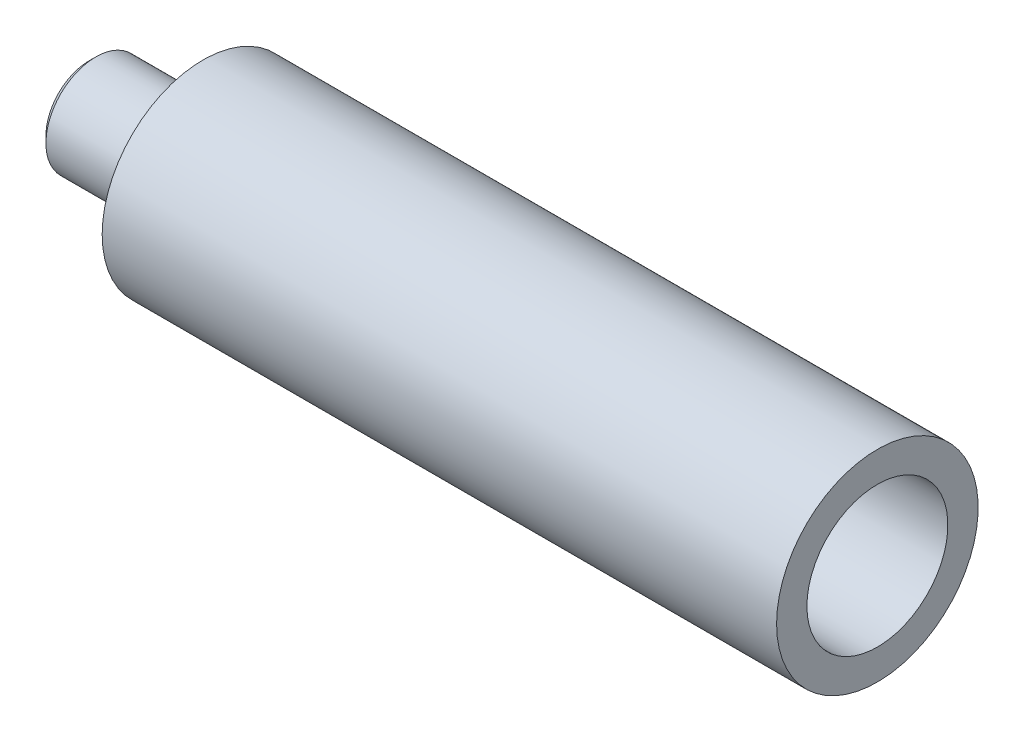
from build123d import *


# Read off the part's stored shape, not the designer's step: G1/4 Straight Pipe Tapped Thread Stud2
with BuildPart() as part:
    # Sketch1 → Revolve1 (revolve)
    with BuildSketch(Plane.XY, mode=Mode.PRIVATE) as revolve1_sk:
        Polygon((15, -13.3), (104, -13.3), (104, -9.3), (19, -9.3), (19, -3), (0, -3), (0, -7), (15, -7), align=None)
    revolve(revolve1_sk.sketch.rotate(Axis((0, 0, 0), (1, 0, 0)), 270), axis=Axis((0, 0, 0), (1, 0, 0)))

    # G1/4 Straight Pipe Tapped Thread Stud2 o → G1/4 Straight Pipe Tapped Thread Stud2 (revolve, cut)
    with BuildSketch(Plane.YX):
        Polygon((5.7225, 0), (7, 0), (7, 15), (6.5785, 15), (6.5785, 0.856), align=None)
    revolve(axis=Axis((0, 0, 0), (1, 0, 0)), mode=Mode.SUBTRACT)


solid = part.part
